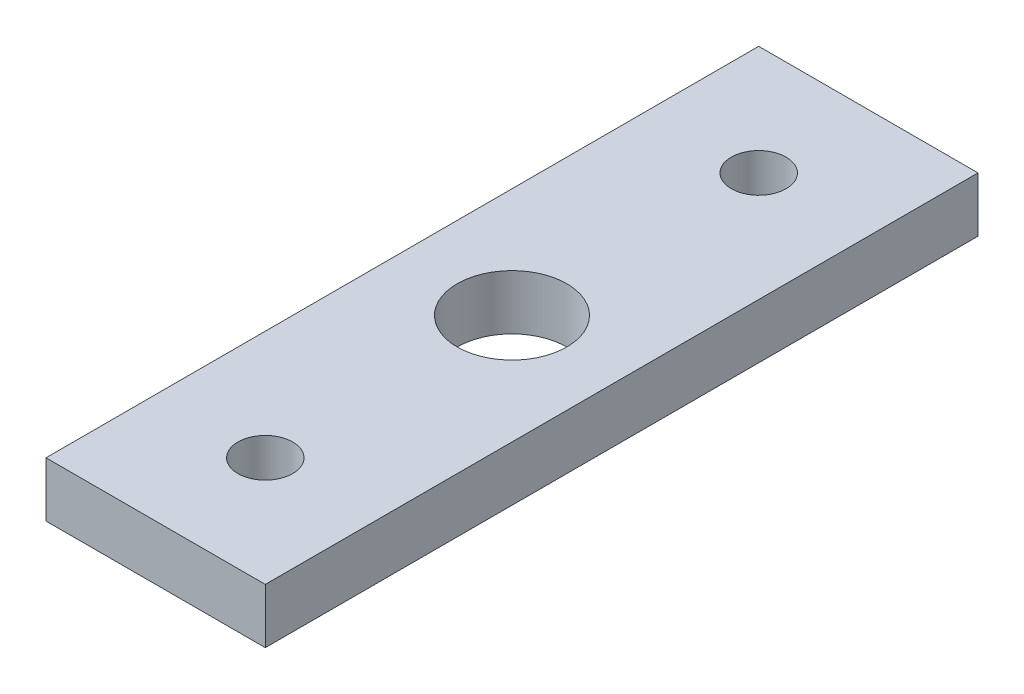
from build123d import *

# Parameters (mm, degrees)
SKETCH1_W           = 25.4
SKETCH1_H           = 82.55
SKETCH1_R           = 6.35
SKETCH1_R_2         = 3.175
BOSS_EXTRUDE1_DEPTH = 6.35


with BuildPart() as part:
    # Sketch1 → Boss-Extrude1 (new body)
    with BuildSketch(Plane(origin=(0, 0, 0), x_dir=(1, 0, 0), z_dir=(0, 1, 0))):
        Rectangle(SKETCH1_W, SKETCH1_H)
        Circle(SKETCH1_R, mode=Mode.SUBTRACT)
        with Locations((0, 28.575)):
            Circle(SKETCH1_R_2, mode=Mode.SUBTRACT)
        with Locations((0, -28.575)):
            Circle(SKETCH1_R_2, mode=Mode.SUBTRACT)
    extrude(amount=BOSS_EXTRUDE1_DEPTH)


solid = part.part
